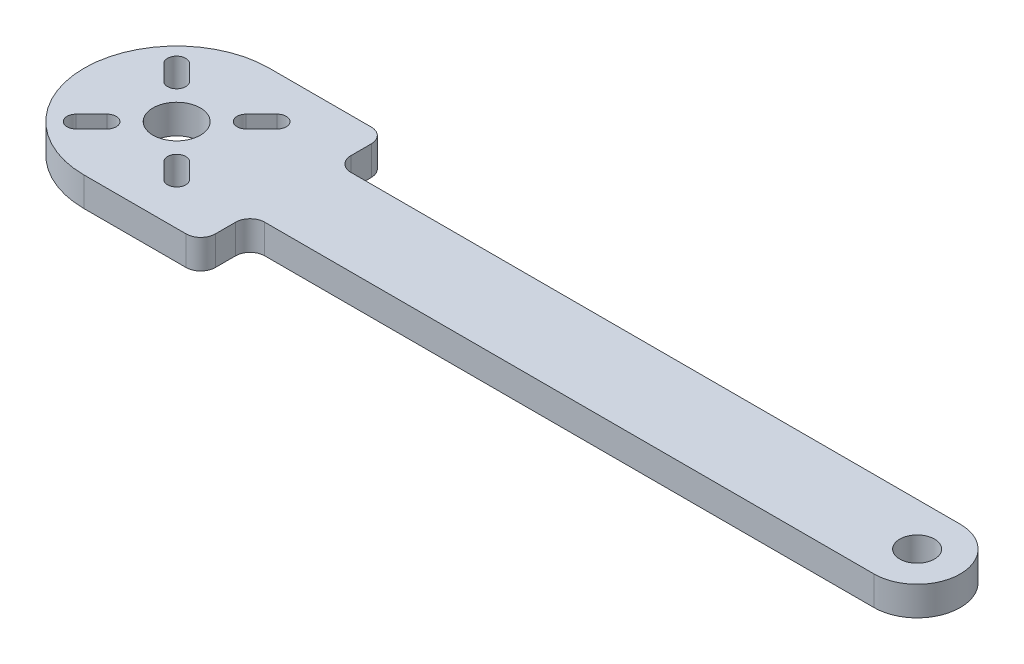
from build123d import *

# Parameters (mm, degrees)
SKETCH1_R           = 3.25
SKETCH1_R_2         = 2.38125
BOSS_EXTRUDE1_DEPTH = 4


with BuildPart() as part:
    # Sketch1 → Boss-Extrude1 (new body)
    with BuildSketch(Plane(origin=(0, 0, 0), x_dir=(1, 0, 0), z_dir=(0, 1, 0))):
        with BuildLine():
            Line((-50.8, 12.7), (-36.8, 12.7))
            ThreePointArc((-36.8, 12.7), (-35.385786438, 12.114213562), (-34.8, 10.7))
            Line((-34.8, 10.7), (-34.8, 7.914556152))
            ThreePointArc((-34.8, 7.914556152), (-34.214213562, 6.500342589), (-32.8, 5.914556152))
            Line((-32.8, 5.914556152), (50.8, 5.914556152))
            ThreePointArc((50.8, 5.914556152), (56.714556152, 0), (50.8, -5.914556152))
            Line((50.8, -5.914556152), (-32.8, -5.914556152))
            ThreePointArc((-32.8, -5.914556152), (-34.214213562, -6.500342589), (-34.8, -7.914556152))
            Line((-34.8, -7.914556152), (-34.8, -10.7))
            ThreePointArc((-34.8, -10.7), (-35.385786438, -12.114213562), (-36.8, -12.7))
            Line((-36.8, -12.7), (-50.8, -12.7))
            ThreePointArc((-50.8, -12.7), (-63.5, 0), (-50.8, 12.7))
        make_face()
        with Locations((-50.8, 0)):
            Circle(SKETCH1_R, mode=Mode.SUBTRACT)
        with Locations((50.8, 0)):
            Circle(SKETCH1_R_2, mode=Mode.SUBTRACT)
        with BuildLine():
            Line((-56.81040764, 7.778174593), (-54.689087297, 5.656854249))
            ThreePointArc((-54.689087297, 5.656854249), (-54.689087297, 3.889087297), (-56.456854249, 3.889087297))
            Line((-56.456854249, 3.889087297), (-58.578174593, 6.01040764))
            ThreePointArc((-58.578174593, 6.01040764), (-58.578174593, 7.778174593), (-56.81040764, 7.778174593))
        make_face(mode=Mode.SUBTRACT)
        with BuildLine():
            Line((-43.021825407, 6.01040764), (-45.143145751, 3.889087297))
            ThreePointArc((-45.143145751, 3.889087297), (-46.910912703, 3.889087297), (-46.910912703, 5.656854249))
            Line((-46.910912703, 5.656854249), (-44.78959236, 7.778174593))
            ThreePointArc((-44.78959236, 7.778174593), (-43.021825407, 7.778174593), (-43.021825407, 6.01040764))
        make_face(mode=Mode.SUBTRACT)
        with BuildLine():
            Line((-44.78959236, -7.778174593), (-46.910912703, -5.656854249))
            ThreePointArc((-46.910912703, -5.656854249), (-46.910912703, -3.889087297), (-45.143145751, -3.889087297))
            Line((-45.143145751, -3.889087297), (-43.021825407, -6.01040764))
            ThreePointArc((-43.021825407, -6.01040764), (-43.021825407, -7.778174593), (-44.78959236, -7.778174593))
        make_face(mode=Mode.SUBTRACT)
        with BuildLine():
            Line((-58.578174593, -6.01040764), (-56.456854249, -3.889087297))
            ThreePointArc((-56.456854249, -3.889087297), (-54.689087297, -3.889087297), (-54.689087297, -5.656854249))
            Line((-54.689087297, -5.656854249), (-56.81040764, -7.778174593))
            ThreePointArc((-56.81040764, -7.778174593), (-58.578174593, -7.778174593), (-58.578174593, -6.01040764))
        make_face(mode=Mode.SUBTRACT)
    extrude(amount=BOSS_EXTRUDE1_DEPTH)


solid = part.part
